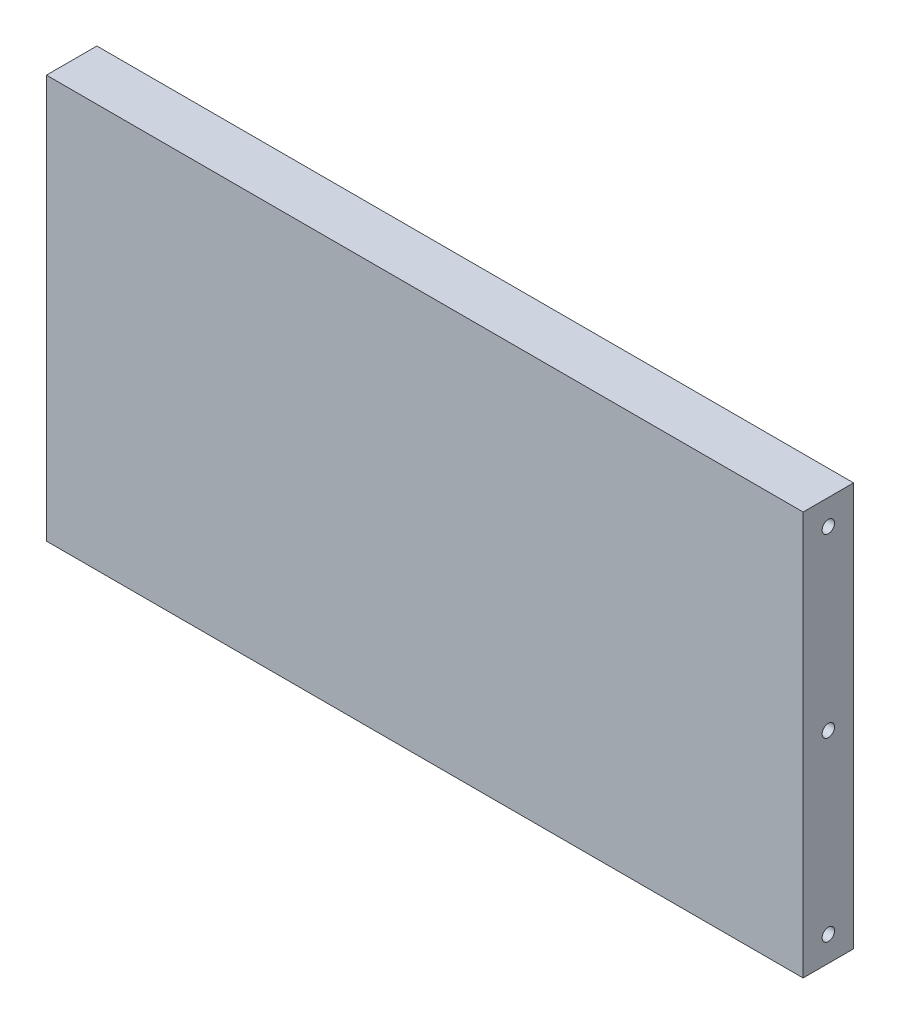
from build123d import *

# Parameters (mm, degrees)
SKIZZE1_W                       = 150
SKIZZE1_H                       = 80
AUFSATZ_LINEAR_AUSTRAGEN1_DEPTH = 10
SKIZZE2_R                       = 1.23
SCHNITT_LINEAR_AUSTRAGEN1_DEPTH = 5
SCHNITT_LINEAR_START            = -5
SKIZZE3_R                       = 1.23
SCHNITT_LINEAR_AUSTRAGEN2_DEPTH = 5


with BuildPart() as part:
    # Skizze1 → Aufsatz-Linear austragen1 (new body)
    with BuildSketch(Plane.XY):
        with Locations((9.444388014, 25.227272727)):
            Rectangle(SKIZZE1_W, SKIZZE1_H)
    extrude(amount=AUFSATZ_LINEAR_AUSTRAGEN1_DEPTH)

    # Skizze2 → Schnitt-Linear austragen1 (cut)
    with BuildSketch(Plane.ZY.offset(65.555611986)):
        with Locations((5, 60.227272727)):
            Circle(SKIZZE2_R)
        with Locations((5, 25.227272727)):
            Circle(SKIZZE2_R)
        with Locations((5, -9.772727273)):
            Circle(SKIZZE2_R)
    extrude(amount=-SCHNITT_LINEAR_AUSTRAGEN1_DEPTH, mode=Mode.SUBTRACT)

    # Skizze3 → Schnitt-Linear austragen2 (cut)
    with BuildSketch(Plane(origin=(84.444388014, 0, 0), x_dir=(0, 0, -1), z_dir=(1, 0, 0)).offset(SCHNITT_LINEAR_START)):
        with Locations((-5, 60.227272727)):
            Circle(SKIZZE3_R)
        with Locations((-5, 25.227272727)):
            Circle(SKIZZE3_R)
        with Locations((-5, -9.772727273)):
            Circle(SKIZZE3_R)
    extrude(amount=SCHNITT_LINEAR_AUSTRAGEN2_DEPTH, mode=Mode.SUBTRACT)


solid = part.part
